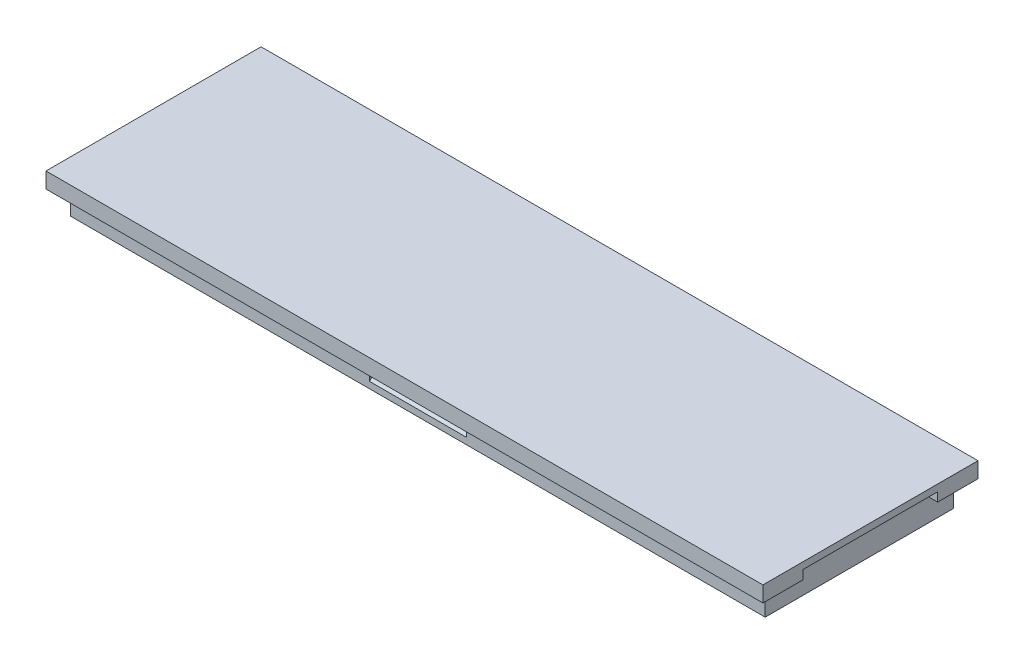
from build123d import *

# Parameters (mm, degrees)
SKETCH1_W           = 80
SKETCH1_H           = 25
BOSS_EXTRUDE1_DEPTH = 1.75
SKETCH2_W           = 77.5
SKETCH2_H           = 21
BOSS_EXTRUDE3_DEPTH = 2.75
CAVITY1_START       = -40
CAVITY1_OUTLINE_W   = 1.75
CAVITY1_OUTLINE_H   = 25
CAVITY1_DEPTH       = 80
CAVITY1_START_2     = -5
CAVITY1_2_DEPTH     = 10
CUT_EXTRUDE1_START  = -0.4
CUT_EXTRUDE1_DEPTH  = 10.8
SKETCH5_W           = 80
SKETCH5_H           = 24
BOSS_EXTRUDE4_DEPTH = 1.75
SKETCH7_W           = 1.25
SKETCH7_H           = 15
CUT_EXTRUDE2_DEPTH  = 1
SKETCH8_W           = 1.25
SKETCH8_H           = 15
BOSS_EXTRUDE5_DEPTH = 1


# Read off the part's stored shape, not the designer's step: Cavity1
with BuildPart() as part:
    # Sketch1 → Boss-Extrude1 (new body)
    with BuildSketch(Plane(origin=(0, 0, 0), x_dir=(1, 0, 0), z_dir=(0, 1, 0))):
        Rectangle(SKETCH1_W, SKETCH1_H)
    extrude(amount=-BOSS_EXTRUDE1_DEPTH)

    # Sketch2 → Boss-Extrude3 (add)
    with BuildSketch(Plane(origin=(0, -1.75, 0), x_dir=(-1, 0, 0), z_dir=(0, -1, 0))):
        Rectangle(SKETCH2_W, SKETCH2_H)
    extrude(amount=BOSS_EXTRUDE3_DEPTH)

    # Cavity1 outline → Cavity1 (cut)
    with BuildSketch(Plane.YZ.offset(CAVITY1_START)):
        with Locations((-0.875, 0)):
            Rectangle(CAVITY1_OUTLINE_W, CAVITY1_OUTLINE_H)
    extrude(amount=CAVITY1_DEPTH, mode=Mode.SUBTRACT)

    # Cavity1 2 outline → Cavity1 2 (cut)
    with BuildSketch(Plane.YZ.offset(CAVITY1_START_2)):
        with BuildLine():
            Line((-2.717157288, 10.282842712), (-2.5, 10.5))
            Line((-2.5, 10.5), (-3.5, 10.5))
            Line((-3.5, 10.5), (-3.282842712, 10.282842712))
            ThreePointArc((-3.282842712, 10.282842712), (-3, 10.165685425), (-2.717157288, 10.282842712))
        make_face()
        with BuildLine():
            Line((-3.5, -10.5), (-2.5, -10.5))
            Line((-2.5, -10.5), (-2.717157288, -10.282842712))
            ThreePointArc((-2.717157288, -10.282842712), (-3, -10.165685425), (-3.282842712, -10.282842712))
            Line((-3.282842712, -10.282842712), (-3.5, -10.5))
        make_face()
    extrude(amount=CAVITY1_2_DEPTH, mode=Mode.SUBTRACT)

    # Sketch4 → Cut-Extrude1 (cut)
    with BuildSketch(Plane(origin=(-5, 0, 0), x_dir=(0, 0, -1), z_dir=(1, 0, 0)).offset(CUT_EXTRUDE1_START)):
        Polygon((-10.800137225, -1.63417735), (-9.57584768, -2.858466895), (-10.943501518, -4.226511252), align=None)
    cut_extrude1 = extrude(amount=CUT_EXTRUDE1_DEPTH, mode=Mode.SUBTRACT)

    # Mirror1: Cut-Extrude1 across plane
    add(cut_extrude1.mirror(Plane.XY), mode=Mode.SUBTRACT)

    # Sketch5 → Boss-Extrude4 (add)
    with BuildSketch(Plane(origin=(0, -1.75, 0), x_dir=(1, 0, 0), z_dir=(0, 1, 0))):
        Rectangle(SKETCH5_W, SKETCH5_H)
    extrude(amount=BOSS_EXTRUDE4_DEPTH)

    # Sketch7 → Cut-Extrude2 (cut)
    with BuildSketch(Plane.XZ.offset(1.75)):
        with Locations((-39.375, 0)):
            Rectangle(SKETCH7_W, SKETCH7_H)
    cut_extrude2 = extrude(amount=-CUT_EXTRUDE2_DEPTH, mode=Mode.SUBTRACT)

    # Mirror2: Cut-Extrude2 across plane
    add(cut_extrude2.mirror(Plane(origin=(0, 0, 0), x_dir=(0, 0, 1), z_dir=(1, 0, 0))), mode=Mode.SUBTRACT)

    # Sketch8 → Boss-Extrude5 (add)
    with BuildSketch(Plane(origin=(0, -0.75, 0), x_dir=(-1, 0, 0), z_dir=(0, -1, 0))):
        with Locations((39.375, 0)):
            Rectangle(SKETCH8_W, SKETCH8_H)
    extrude(amount=BOSS_EXTRUDE5_DEPTH)


solid = part.part
